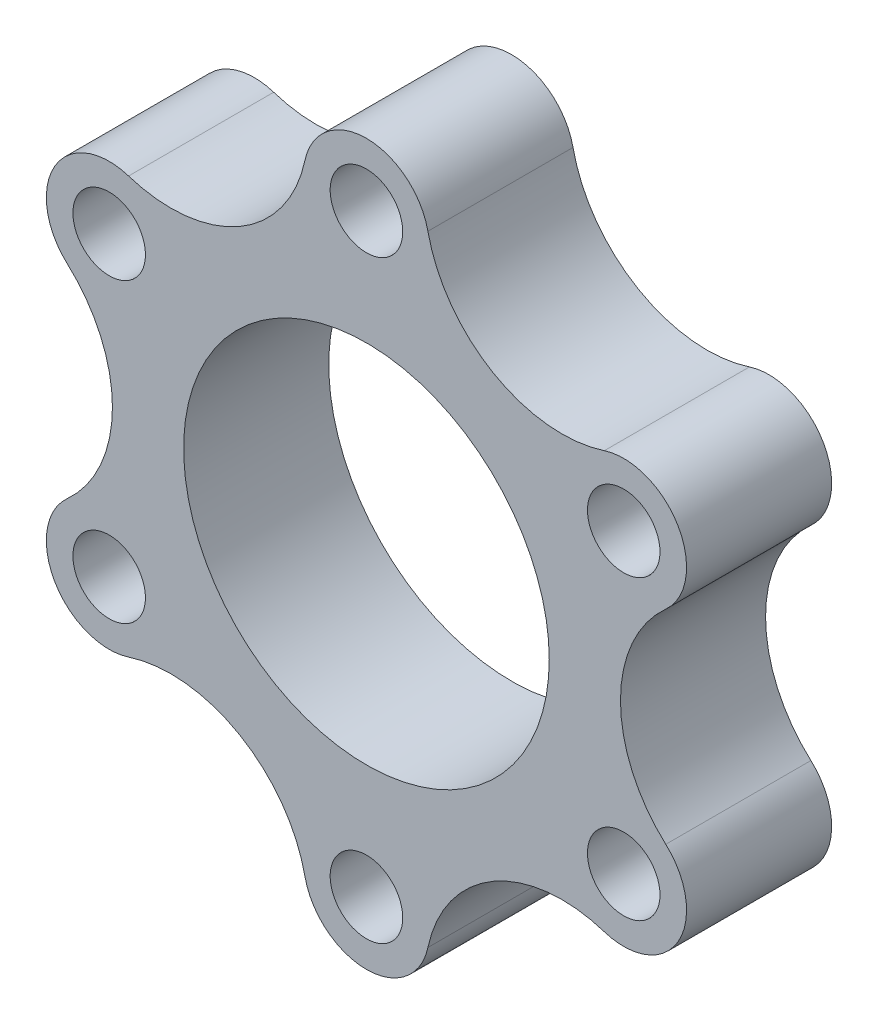
from build123d import *

# Parameters (mm, degrees)
SKETCH1_R           = 16
SKETCH1_R_2         = 3.175
BOSS_EXTRUDE1_DEPTH = 6.35


with BuildPart() as part:
    # Sketch1 → Boss-Extrude1 (new, symmetric)
    with BuildSketch(Plane.XY):
        with BuildLine():
            ThreePointArc((5.379319788, 27.145826611), (0, 31.5), (-5.379319788, 27.145826611))
            ThreePointArc((-5.379319788, 27.145826611), (-11.116017506, 19.253507098), (-20.819315558, 18.231540897))
            ThreePointArc((-20.819315558, 18.231540897), (-27.279800219, 15.75), (-26.198635346, 8.914285714))
            ThreePointArc((-26.198635346, 8.914285714), (-22.232035012, 0), (-26.198635346, -8.914285714))
            ThreePointArc((-26.198635346, -8.914285714), (-27.279800219, -15.75), (-20.819315558, -18.231540897))
            ThreePointArc((-20.819315558, -18.231540897), (-11.116017506, -19.253507098), (-5.379319788, -27.145826611))
            ThreePointArc((-5.379319788, -27.145826611), (0, -31.5), (5.379319788, -27.145826611))
            ThreePointArc((5.379319788, -27.145826611), (11.116017506, -19.253507098), (20.819315558, -18.231540897))
            ThreePointArc((20.819315558, -18.231540897), (27.279800219, -15.75), (26.198635346, -8.914285714))
            ThreePointArc((26.198635346, -8.914285714), (22.232035012, 0), (26.198635346, 8.914285714))
            ThreePointArc((26.198635346, 8.914285714), (27.279800219, 15.75), (20.819315558, 18.231540897))
            ThreePointArc((20.819315558, 18.231540897), (11.116017506, 19.253507098), (5.379319788, 27.145826611))
        make_face()
        Circle(SKETCH1_R, mode=Mode.SUBTRACT)
        with Locations((0, 26)):
            Circle(SKETCH1_R_2, mode=Mode.SUBTRACT)
        with Locations((22.516660498, 13)):
            Circle(SKETCH1_R_2, mode=Mode.SUBTRACT)
        with Locations((22.516660498, -13)):
            Circle(SKETCH1_R_2, mode=Mode.SUBTRACT)
        with Locations((0, -26)):
            Circle(SKETCH1_R_2, mode=Mode.SUBTRACT)
        with Locations((-22.516660498, -13)):
            Circle(SKETCH1_R_2, mode=Mode.SUBTRACT)
        with Locations((-22.516660498, 13)):
            Circle(SKETCH1_R_2, mode=Mode.SUBTRACT)
    extrude(amount=BOSS_EXTRUDE1_DEPTH, both=True)


solid = part.part
